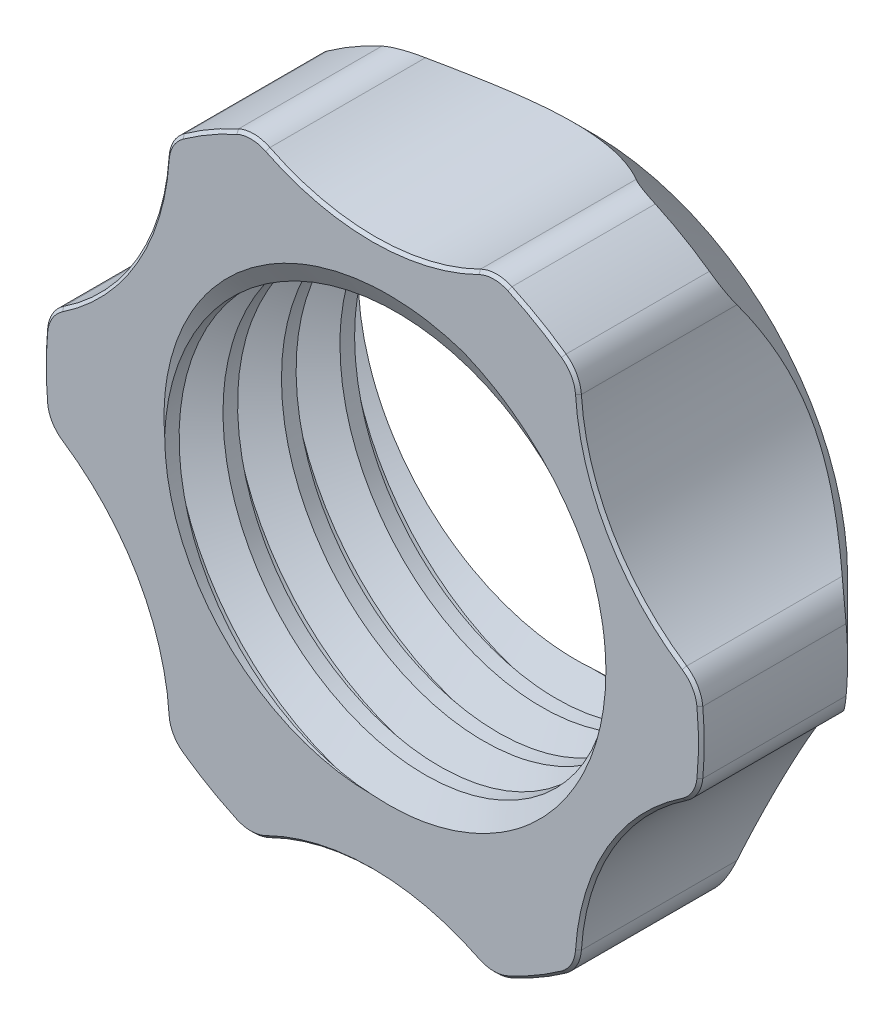
from build123d import *

# Parameters (mm, degrees)
SKETCH1_R                = 22.5
BOSS_EXTRUDE1_DEPTH      = 15
SKETCH2_R                = 14.2
CUT_EXTRUDE1_DEPTH       = 36.178118199
THREAD1_PITCH            = 4
CHAMFER1_SIZE            = 5
SKETCH5_R                = 16.25
CUT_EXTRUDE2_DEPTH       = 36.178118374
FILLET1_R                = 2.5
CIRPATTERN1_COUNT        = 6
FILLET1_OF_CIRPATTERN1_R = 2.5
CHAMFER2_SIZE            = 0.2


with BuildPart() as part:
    # Sketch1 → Boss-Extrude1 (new body)
    with BuildSketch(Plane.XY):
        Circle(SKETCH1_R)
    extrude(amount=BOSS_EXTRUDE1_DEPTH)

    # Sketch2 → Cut-Extrude1 (cut, through all)
    with BuildSketch(Plane.XY.offset(15)):
        Circle(SKETCH2_R)
    extrude(amount=-CUT_EXTRUDE1_DEPTH, mode=Mode.SUBTRACT)

    # Thread1: the profile of Thread Profile1 profile screwed along a right-hand helix of 4.5 turns, 12 arcs to a turn; built about Z, then put on its axis
    thread1_z = Axis((0, 0, 0), (0, 0, 1))
    thread1_corners = [(14.1997, 0, -0.000173205), (16.3650635, 0, 1.249999995), (16.3650635, 0, 1.749999995), (14.1997, 0, 3.000173194)]
    with BuildLine(mode=Mode.PRIVATE) as thread1_profile:
        Line(thread1_corners[0], thread1_corners[1])
        Line(thread1_corners[1], thread1_corners[2])
        Line(thread1_corners[2], thread1_corners[3])
        Line(thread1_corners[3], thread1_corners[0])
    thread1_cap = Face(thread1_profile.wire())
    thread1_turn_angles = [0, 15, 30, 45, 60, 75, 90, 105, 120, 135, 150, 165, 180, 195, 210, 225, 240, 255, 270, 285, 300, 315, 330, 345, 360]
    thread1_turn_weights = [1, 0.9659258262890683, 1, 0.9659258262890683, 1, 0.9659258262890683, 1, 0.9659258262890683, 1, 0.9659258262890683, 1, 0.9659258262890683, 1, 0.9659258262890683, 1, 0.9659258262890683, 1, 0.9659258262890683, 1, 0.9659258262890683, 1, 0.9659258262890683, 1, 0.9659258262890683, 1]
    thread1_turn_rails = [Edge.make_bspline([Vector(p[0], p[1], 0).rotate(thread1_z, thread1_turn_angles[k]) / thread1_turn_weights[k] + Vector(0, 0, p[2] + THREAD1_PITCH * thread1_turn_angles[k] / 360) for k in range(25)], [0, 0, 0, 1, 1, 2, 2, 3, 3, 4, 4, 5, 5, 6, 6, 7, 7, 8, 8, 9, 9, 10, 10, 11, 11, 12, 12, 12], 2, thread1_turn_weights) for p in thread1_corners]
    thread1_turn_sides = [Face.make_surface_from_curves(thread1_turn_rails[p[0]], thread1_turn_rails[p[1]]) for p in [(0, 1), (1, 2), (2, 3), (3, 0)]]
    thread1_last_angles = [1440, 1455, 1470, 1485, 1500, 1515, 1530, 1545, 1560, 1575, 1590, 1605, 1620]
    thread1_last_weights = [1, 0.9659258262890683, 1, 0.9659258262890683, 1, 0.9659258262890683, 1, 0.9659258262890683, 1, 0.9659258262890683, 1, 0.9659258262890683, 1]
    thread1_last_rails = [Edge.make_bspline([Vector(p[0], p[1], 0).rotate(thread1_z, thread1_last_angles[k]) / thread1_last_weights[k] + Vector(0, 0, p[2] + THREAD1_PITCH * thread1_last_angles[k] / 360) for k in range(13)], [0, 0, 0, 1, 1, 2, 2, 3, 3, 4, 4, 5, 5, 6, 6, 6], 2, thread1_last_weights) for p in thread1_corners]
    thread1_last_sides = [Face.make_surface_from_curves(thread1_last_rails[p[0]], thread1_last_rails[p[1]]) for p in [(0, 1), (1, 2), (2, 3), (3, 0)]]
    thread1 = Plane(origin=(0, 0, 18), x_dir=(-1, 0, 0), z_dir=(0, 0, -1)) * Solid(Shell([*[p.moved(Location((0, 0, THREAD1_PITCH * i))) for i in range(4) for p in thread1_turn_sides], *thread1_last_sides, thread1_cap, thread1_cap.rotate(thread1_z, 1620).moved(Location((0, 0, THREAD1_PITCH * 1620 / 360)))]))
    add(thread1, mode=Mode.SUBTRACT)

    # Chamfer1
    chamfer1_edges = [part.edges().sort_by_distance(p)[0] for p in [
        (-22.5, 0, 0),
    ]]
    chamfer(chamfer1_edges, length=CHAMFER1_SIZE)

    # Sketch5 → Cut-Extrude2 (cut, through all)
    with BuildSketch(Plane.XY):
        with Locations((0, 35)):
            Circle(SKETCH5_R)
    cut_extrude2 = extrude(amount=CUT_EXTRUDE2_DEPTH, mode=Mode.SUBTRACT)

    # Fillet1
    fillet1_edges = [part.edges().sort_by_distance(p)[0] for p in [
        (8.181435429, 20.959821429, 10),
        (-8.181435429, 20.959821429, 10),
    ]]
    fillet(fillet1_edges, radius=FILLET1_R)

    # CirPattern1: Cut-Extrude2 ×6 about axis
    cirpattern1_axis = Axis((0, 0, 0), (0, 0, 1))
    for i in range(1, CIRPATTERN1_COUNT):
        add(cut_extrude2.rotate(cirpattern1_axis, i * 360 / CIRPATTERN1_COUNT), mode=Mode.SUBTRACT)

    # Fillet1 of CirPattern1
    fillet1_of_cirpattern1_edges = [part.edges().sort_by_distance(p)[0] for p in [
        (-14.061020101, 17.565241635, 10),
        (-22.242455531, 3.394579793, 10),
        (-22.242455531, -3.394579793, 10),
        (-14.061020101, -17.565241635, 10),
        (-8.181435429, -20.959821429, 10),
        (8.181435429, -20.959821429, 10),
        (14.061020101, -17.565241635, 10),
        (22.242455531, -3.394579793, 10),
        (22.242455531, 3.394579793, 10),
        (14.061020101, 17.565241635, 10),
    ]]
    fillet(fillet1_of_cirpattern1_edges, radius=FILLET1_OF_CIRPATTERN1_R)

    # Chamfer2
    chamfer2_edges = [part.edges().sort_by_distance(p)[0] for p in [
        (16.237976321, 9.375, 15),
        (11.25, 19.485571585, 15),
        (13.783791533, 17.50911335, 15),
        (22.055232726, 3.182556953, 15),
        (16.237976321, -9.375, 15),
        (22.5, 0, 15),
        (22.055232726, -3.182556953, 15),
        (13.783791533, -17.50911335, 15),
        (0, -18.75, 15),
        (11.25, -19.485571585, 15),
        (8.271441193, -20.691670303, 15),
        (-8.271441193, -20.691670303, 15),
        (-16.237976321, -9.375, 15),
        (-11.25, -19.485571585, 15),
        (-13.783791533, -17.50911335, 15),
        (-22.055232726, -3.182556953, 15),
        (-16.237976321, 9.375, 15),
        (-22.5, 0, 15),
        (-22.055232726, 3.182556953, 15),
        (-13.783791533, 17.50911335, 15),
        (0, 18.75, 15),
        (-11.25, 19.485571585, 15),
        (-8.271441193, 20.691670303, 15),
        (8.271441193, 20.691670303, 15),
    ]]
    chamfer(chamfer2_edges, length=CHAMFER2_SIZE)


solid = part.part
